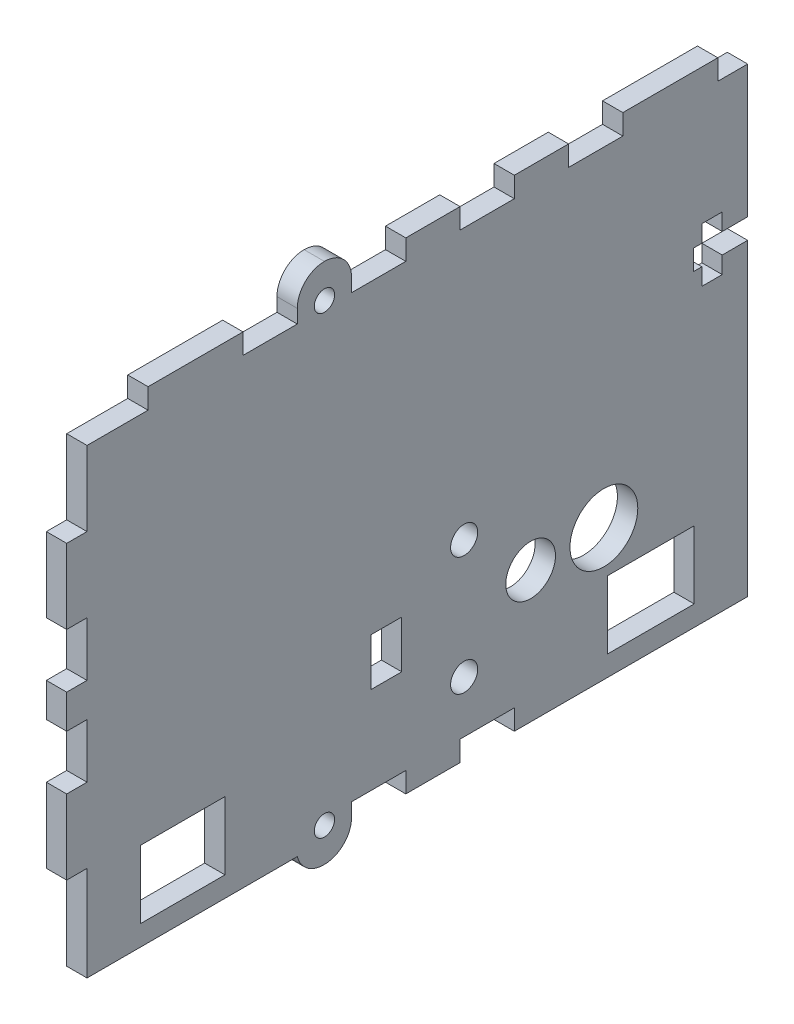
from build123d import *

# Parameters (mm, degrees)
CROQUIS1_W              = 108
CROQUIS1_H              = 71
SALIENTE_EXTRUIR1_DEPTH = 1.5
CROQUIS2_W              = 8
CROQUIS2_H              = 3
CROQUIS2_W_2            = 12
CORTAR_EXTRUIR1_DEPTH   = 3
CROQUIS4_W              = 8
CROQUIS4_H              = 3
SALIENTE_EXTRUIR2_DEPTH = 3
REDONDEO1_R             = 4
CROQUIS5_R              = 1.5
CORTAR_EXTRUIR2_DEPTH   = 13
SIMETR_A2_START         = -1.5
SIMETR_A2_OUTLINE_R     = 1.5
SIMETR_A2_DEPTH         = 3
SIMETR_A2_2_DEPTH       = 3
CROQUIS6_W              = 3
CROQUIS6_H              = 14
CROQUIS6_H_2            = 8
CORTAR_EXTRUIR3_DEPTH   = 3
CROQUIS7_W              = 3.217414859
CROQUIS7_H              = 7.6
CORTAR_EXTRUIR4_DEPTH   = 73
CROQUIS10_W             = 12.8
CROQUIS10_H             = 9.989091156
CORTAR_EXTRUIR7_DEPTH   = 10
CROQUIS11_W             = 12.481361742
CROQUIS11_H             = 10
CORTAR_EXTRUIR8_DEPTH   = 10
CROQUIS12_R             = 2
CROQUIS12_R_2           = 3.661926667
CROQUIS12_R_3           = 5
CROQUIS12_W             = 4.5
CROQUIS12_H             = 7
CORTAR_EXTRUIR9_DEPTH   = 10
CORTAR_EXTRUIR10_DEPTH  = 10


# Read off the part's stored shape, not the designer's step: Simetría2
with BuildPart() as part:
    # Croquis1 → Saliente-Extruir1 (new, symmetric)
    with BuildSketch(Plane(origin=(0, 0, 0), x_dir=(0, 0, -1), z_dir=(1, 0, 0))):
        Rectangle(CROQUIS1_W, CROQUIS1_H)
    extrude(amount=SALIENTE_EXTRUIR1_DEPTH, both=True)

    # Croquis2 → Cortar-Extruir1 (cut)
    with BuildSketch(Plane.ZY.offset(1.5)):
        with Locations((-8, -34)):
            Rectangle(CROQUIS2_W, CROQUIS2_H)
        with Locations((8, -34)):
            Rectangle(CROQUIS2_W, CROQUIS2_H)
        with Locations((48, 34)):
            Rectangle(CROQUIS2_W_2, CROQUIS2_H)
        with Locations((24, 34)):
            Rectangle(CROQUIS2_W, CROQUIS2_H)
        with Locations((8, 34)):
            Rectangle(CROQUIS2_W, CROQUIS2_H)
        with Locations((-8, 34)):
            Rectangle(CROQUIS2_W, CROQUIS2_H)
        with Locations((-24, 34)):
            Rectangle(CROQUIS2_W, CROQUIS2_H)
        with Locations((-48, 34)):
            Rectangle(CROQUIS2_W_2, CROQUIS2_H)
    extrude(amount=-CORTAR_EXTRUIR1_DEPTH, mode=Mode.SUBTRACT)

    # Croquis4 → Saliente-Extruir2 (add)
    with BuildSketch(Plane.ZY.offset(1.5)):
        with Locations((16, 37)):
            Rectangle(CROQUIS4_W, CROQUIS4_H)
    extrude(amount=-SALIENTE_EXTRUIR2_DEPTH)

    # Redondeo1
    redondeo1_edges = [part.edges().sort_by_distance(p)[0] for p in [
        (0, 38.5, 20),
        (0, 38.5, 12),
    ]]
    fillet(redondeo1_edges, radius=REDONDEO1_R - 0.0001)  # a hair under: the kernel refuses the full size

    # Croquis5 → Cortar-Extruir2 (cut)
    with BuildSketch(Plane.ZY.offset(1.5)):
        with Locations((16, 33.5)):
            Circle(CROQUIS5_R)
    extrude(amount=-CORTAR_EXTRUIR2_DEPTH, mode=Mode.SUBTRACT)

    # Simetría2 outline → Simetría2 (cut)
    with BuildSketch(Plane.YZ.offset(SIMETR_A2_START)):
        with BuildLine():
            ThreePointArc((-34.5, 12), (-35.00401717, 12.031881215), (-35.5, 12.127016654))
            Line((-35.5, 12.127016654), (-35.5, 12))
            Line((-35.5, 12), (-34.5, 12))
        make_face()
        with Locations((-33.5, 16)):
            Circle(SIMETR_A2_OUTLINE_R)
    extrude(amount=SIMETR_A2_DEPTH, mode=Mode.SUBTRACT)

    # Simetr_a2 2 outline → Simetr_a2 2 (add)
    with BuildSketch(Plane.YZ.offset(SIMETR_A2_START)):
        with BuildLine():
            ThreePointArc((-35.5, 20), (-37.66227766, 18.576506397), (-38.5, 16.127016654))
            Line((-38.5, 16.127016654), (-38.5, 16))
            ThreePointArc((-38.5, 16), (-37.66227766, 13.550510257), (-35.5, 12.127016654))
            Line((-35.5, 12.127016654), (-35.5, 20))
        make_face()
    extrude(amount=SIMETR_A2_2_DEPTH)

    # Croquis6 → Cortar-Extruir3 (cut)
    with BuildSketch(Plane.ZY.offset(1.5)):
        with Locations((52.5, -28.5)):
            Rectangle(CROQUIS6_W, CROQUIS6_H)
        with Locations((52.5, -6.5)):
            Rectangle(CROQUIS6_W, CROQUIS6_H_2)
        with Locations((52.5, 6.5)):
            Rectangle(CROQUIS6_W, CROQUIS6_H_2)
        with Locations((52.5, 28.5)):
            Rectangle(CROQUIS6_W, CROQUIS6_H)
    extrude(amount=-CORTAR_EXTRUIR3_DEPTH, mode=Mode.SUBTRACT)

    # Croquis7 → Cortar-Extruir4 (cut)
    with BuildSketch(Plane(origin=(0, 32.5, 0), x_dir=(1, 0, 0), z_dir=(0, 1, 0))):
        with Locations((-0.10870743, 50.2)):
            Rectangle(CROQUIS7_W, CROQUIS7_H)
    extrude(amount=-CORTAR_EXTRUIR4_DEPTH, mode=Mode.SUBTRACT)

    # Croquis10 → Cortar-Extruir7 (cut)
    with BuildSketch(Plane.ZY.offset(1.5)):
        with Locations((-32.123797493, -27.505454422)):
            Rectangle(CROQUIS10_W, CROQUIS10_H)
    extrude(amount=-CORTAR_EXTRUIR7_DEPTH, mode=Mode.SUBTRACT)

    # Croquis11 → Cortar-Extruir8 (cut)
    with BuildSketch(Plane.ZY.offset(1.5)):
        with Locations((36.9, -27.5)):
            Rectangle(CROQUIS11_W, CROQUIS11_H)
    extrude(amount=-CORTAR_EXTRUIR8_DEPTH, mode=Mode.SUBTRACT)

    # Croquis12 → Cortar-Extruir9 (cut)
    with BuildSketch(Plane(origin=(1.5, 0, 0), x_dir=(0, 0, -1), z_dir=(1, 0, 0))):
        with Locations((4.6, -7.355454422)):
            Circle(CROQUIS12_R)
        with Locations((4.6, -24.855454422)):
            Circle(CROQUIS12_R)
        with Locations((14.4, -16.105454422)):
            Circle(CROQUIS12_R_2)
        with Locations((25.2, -16.105454422)):
            Circle(CROQUIS12_R_3)
        with Locations((-6.85, -16.105454422)):
            Rectangle(CROQUIS12_W, CROQUIS12_H)
    extrude(amount=-CORTAR_EXTRUIR9_DEPTH, mode=Mode.SUBTRACT)

    # Croquis13 → Cortar-Extruir10 (cut)
    with BuildSketch(Plane(origin=(1.5, 0, 0), x_dir=(0, 0, -1), z_dir=(1, 0, 0))):
        Polygon((46.4, 9.99), (46.4, 12.99), (42.65, 12.99), (42.65, 15.49), (39.65, 15.49), (39.65, 12.99), (38.4, 12.99), (38.4, 9.99), (39.65, 9.99), (39.65, 7.49), (42.65, 7.49), (42.65, 9.99), align=None)
    extrude(amount=-CORTAR_EXTRUIR10_DEPTH, mode=Mode.SUBTRACT)


solid = part.part
